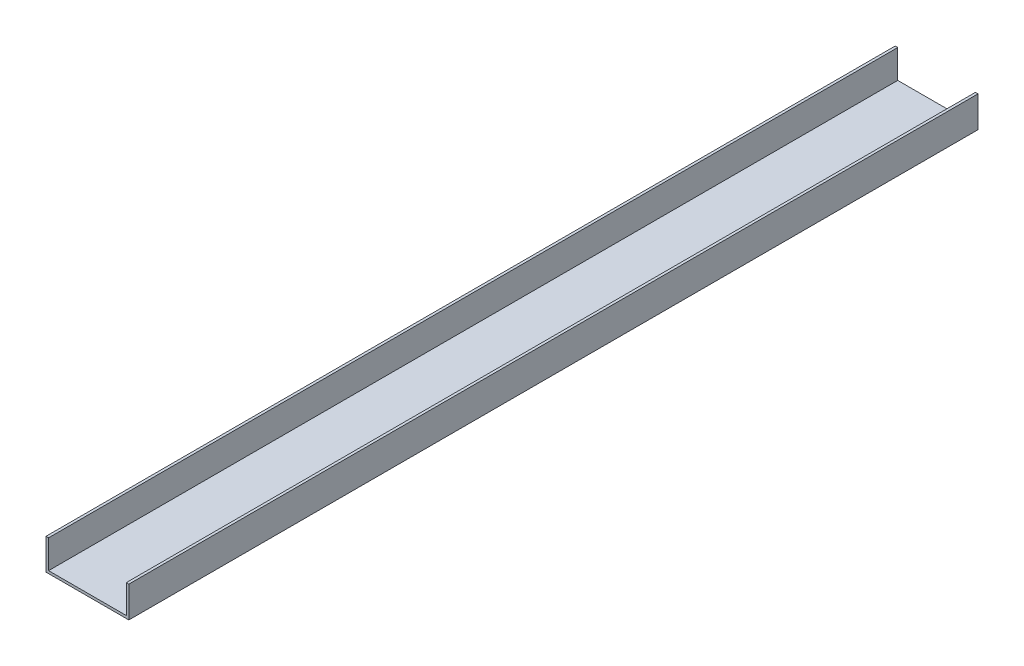
from build123d import *

# Parameters (mm, degrees)
BOSS_EXTRUDE2_DEPTH = 260.35


with BuildPart() as part:
    # Sketch3 → Boss-Extrude2 (new, symmetric)
    with BuildSketch(Plane.XY):
        Polygon((-25.4, 9.525), (-25.4, -9.525), (25.4, -9.525), (25.4, 9.525), (23.8125, 9.525), (23.8125, -7.9375), (-23.8125, -7.9375), (-23.8125, 9.525), align=None)
    extrude(amount=BOSS_EXTRUDE2_DEPTH, both=True)


solid = part.part
